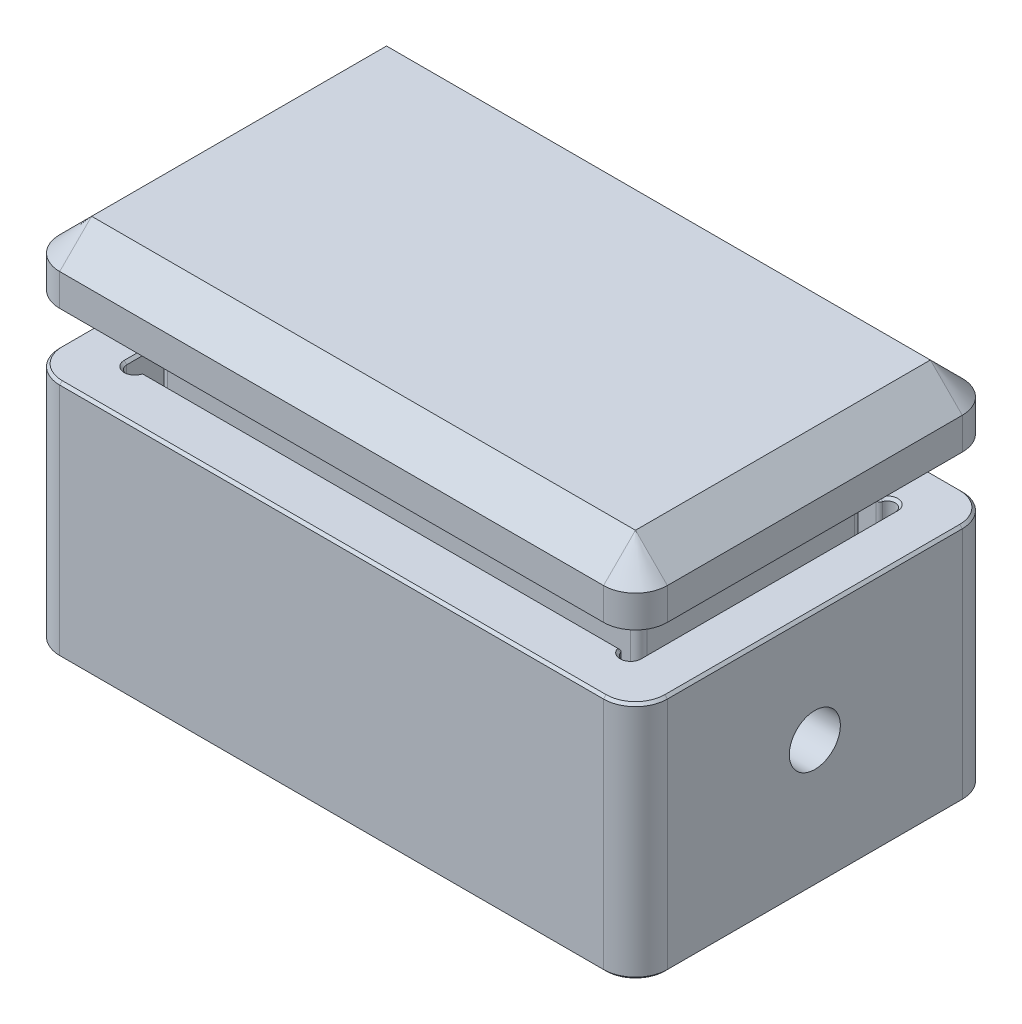
from build123d import *

# Parameters (mm, degrees)
SKETCH1_W           = 60.452
SKETCH1_H           = 35.687
BOSS_EXTRUDE1_DEPTH = 23.8125
FILLET1_R           = 3.175
FILLET2_R           = 0.4
SKETCH2_W           = 47.6758
SKETCH2_H           = 22.2758
BOSS_EXTRUDE2_DEPTH = 6.35
SKETCH2_4_W         = 47.6758
SKETCH2_4_H         = 22.2758
BOSS_EXTRUDE3_DEPTH = 30.1625
CHAMFER1_SIZE       = 3.175
CHAMFER2_SIZE       = 4.7625
CHAMFER3_SIZE       = 0.254
FILLET3_R           = 0.810638298
SKETCH3_R           = 2.54
CUT_EXTRUDE1_DEPTH  = 77.970094253


with BuildPart() as part:
    # Sketch1 → Boss-Extrude1 (new body)
    with BuildSketch(Plane(origin=(0, 0, 0), x_dir=(1, 0, 0), z_dir=(0, 1, 0))):
        with Locations((25.4635, 12.7635)):
            Rectangle(SKETCH1_W, SKETCH1_H)
        with BuildLine():
            Line((1.599999848, 0), (49.327000152, 0))
            ThreePointArc((49.327000152, 0), (50.127000076, -0.799999924), (50.927, 0))
            Line((50.927, 0), (50.927, 25.527))
            ThreePointArc((50.927, 25.527), (50.127000076, 26.326999924), (49.327000152, 25.527))
            Line((49.327000152, 25.527), (1.599999848, 25.527))
            ThreePointArc((1.599999848, 25.527), (0.799999924, 26.326999924), (0, 25.527))
            Line((0, 25.527), (0, 0))
            ThreePointArc((0, 0), (0.799999924, -0.799999924), (1.599999848, 0))
        make_face(mode=Mode.SUBTRACT)
    extrude(amount=BOSS_EXTRUDE1_DEPTH)

    # Fillet1
    fillet1_edges = [part.edges().sort_by_distance(p)[0] for p in [
        (-4.7625, 11.90625, -30.607),
        (55.6895, 11.90625, -30.607),
        (55.6895, 11.90625, 5.08),
        (-4.7625, 11.90625, 5.08),
    ]]
    fillet(fillet1_edges, radius=FILLET1_R)

    # Fillet2
    fillet2_edges = [part.edges().sort_by_distance(p)[0] for p in [
        (1.599999848, 11.90625, 0),
        (49.327000152, 11.90625, 0),
        (49.327000152, 11.90625, -25.527),
        (1.599999848, 11.90625, -25.527),
    ]]
    fillet(fillet2_edges, radius=FILLET2_R)

    # Chamfer3
    chamfer3_edges = [part.edges().sort_by_distance(p)[0] for p in [
        (0.664718345, 0, 0.788478771),
        (50.927, 0, -12.7635),
        (50.262281655, 0, -26.315478771),
        (0, 0, -12.7635),
        (0.664718345, 23.8125, 0.788478771),
        (50.927, 23.8125, -12.7635),
        (50.262281655, 23.8125, -26.315478771),
        (0, 23.8125, -12.7635),
        (-4.7625, 0, -12.7635),
        (-4.7625, 23.8125, -12.7635),
        (25.4635, 0, -30.607),
        (55.6895, 0, -12.7635),
        (25.4635, 0, 5.08),
        (-3.83256403, 0, 4.15006403),
        (54.75956403, 0, 4.15006403),
        (54.75956403, 0, -29.67706403),
        (-3.83256403, 0, -29.67706403),
        (25.4635, 23.8125, -30.607),
        (25.4635, 23.8125, 5.08),
        (55.6895, 23.8125, -12.7635),
        (-3.83256403, 23.8125, 4.15006403),
        (54.75956403, 23.8125, 4.15006403),
        (54.75956403, 23.8125, -29.67706403),
        (-3.83256403, 23.8125, -29.67706403),
        (25.4635, 0, 0),
        (25.4635, 23.8125, 0),
        (50.262281655, 0, 0.788478771),
        (25.4635, 0, -25.527),
        (0.664718345, 0, -26.315478771),
        (1.700430589, 0, 0.073401365),
        (1.700430589, 0, -25.600401365),
        (49.226569411, 0, -25.600401365),
        (49.226569411, 0, 0.073401365),
        (50.262281655, 23.8125, 0.788478771),
        (0.664718345, 23.8125, -26.315478771),
        (25.4635, 23.8125, -25.527),
        (1.700430589, 23.8125, 0.073401365),
        (1.700430589, 23.8125, -25.600401365),
        (49.226569411, 23.8125, -25.600401365),
        (49.226569411, 23.8125, 0.073401365),
    ]]
    chamfer(chamfer3_edges, length=CHAMFER3_SIZE)


with BuildPart() as body_2:
    # Sketch2 → Boss-Extrude2 (new body)
    # profile 1 of 2: a face of its own
    with BuildSketch(Plane(origin=(0, 30.1625, 0), x_dir=(1, 0, 0), z_dir=(0, 1, 0))):
        with BuildLine():
            Line((55.6895, -1.905), (55.6895, 27.432))
            ThreePointArc((55.6895, 27.432), (54.75956403, 29.67706403), (52.5145, 30.607))
            Line((52.5145, 30.607), (-1.5875, 30.607))
            ThreePointArc((-1.5875, 30.607), (-3.83256403, 29.67706403), (-4.7625, 27.432))
            Line((-4.7625, 27.432), (-4.7625, -1.905))
            ThreePointArc((-4.7625, -1.905), (-3.83256403, -4.15006403), (-1.5875, -5.08))
            Line((-1.5875, -5.08), (52.5145, -5.08))
            ThreePointArc((52.5145, -5.08), (54.75956403, -4.15006403), (55.6895, -1.905))
        make_face()
        with Locations((25.4635, 12.7635)):
            Rectangle(SKETCH2_W, SKETCH2_H, mode=Mode.SUBTRACT)
    # profile 2 of 2: a face of its own
    with BuildSketch(Plane(origin=(0, 30.1625, 0), x_dir=(1, 0, 0), z_dir=(0, 1, 0))):
        with Locations((25.4635, 12.7635)):
            Rectangle(SKETCH2_W, SKETCH2_H)
    extrude(amount=BOSS_EXTRUDE2_DEPTH)

    # Sketch2<4> → Boss-Extrude3 (add)
    with BuildSketch(Plane(origin=(0, 30.1625, 0), x_dir=(1, 0, 0), z_dir=(0, 1, 0))):
        with Locations((25.4635, 12.7635)):
            Rectangle(SKETCH2_4_W, SKETCH2_4_H)
    extrude(amount=-BOSS_EXTRUDE3_DEPTH)

    # Chamfer1
    chamfer1_edges = [body_2.edges().sort_by_distance(p)[0] for p in [
        (54.75956403, 36.5125, -29.67706403),
        (25.4635, 36.5125, -30.607),
        (-3.83256403, 36.5125, -29.67706403),
        (-4.7625, 36.5125, -12.7635),
        (-3.83256403, 36.5125, 4.15006403),
        (25.4635, 36.5125, 5.08),
        (54.75956403, 36.5125, 4.15006403),
        (55.6895, 36.5125, -12.7635),
    ]]
    chamfer(chamfer1_edges, length=CHAMFER1_SIZE - 0.0001)  # a hair under: the kernel refuses the full size

    # Chamfer2
    chamfer2_edges = [body_2.edges().sort_by_distance(p)[0] for p in [
        (1.6256, 0, -12.7635),
        (25.4635, 0, -23.9014),
        (49.3014, 0, -12.7635),
        (25.4635, 0, -1.6256),
    ]]
    chamfer(chamfer2_edges, length=CHAMFER2_SIZE)

    # Fillet3
    fillet3_edges = [body_2.edges().sort_by_distance(p)[0] for p in [
        (1.6256, 17.4625, -23.9014),
        (1.6256, 17.4625, -1.6256),
        (49.3014, 17.4625, -1.6256),
        (49.3014, 17.4625, -23.9014),
    ]]
    fillet(fillet3_edges, radius=FILLET3_R)


with BuildPart() as cut_extrude1_tool:
    # Sketch3 → Cut-Extrude1 (new, through all)
    with BuildSketch(Plane(origin=(55.6895, 0, 0), x_dir=(0, 0, -1), z_dir=(1, 0, 0))):
        with Locations((12.7635, 12.7)):
            Circle(SKETCH3_R)
    extrude(amount=-CUT_EXTRUDE1_DEPTH)


with BuildPart() as part_1:
    add(part.part)

    # Cut-Extrude1: cut by cut_extrude1_tool
    add(cut_extrude1_tool.part, mode=Mode.SUBTRACT)


with BuildPart() as body_2_1:
    add(body_2.part)

    # Cut-Extrude1: cut by cut_extrude1_tool
    add(cut_extrude1_tool.part, mode=Mode.SUBTRACT)


solid = Compound([part_1.part, body_2_1.part])
